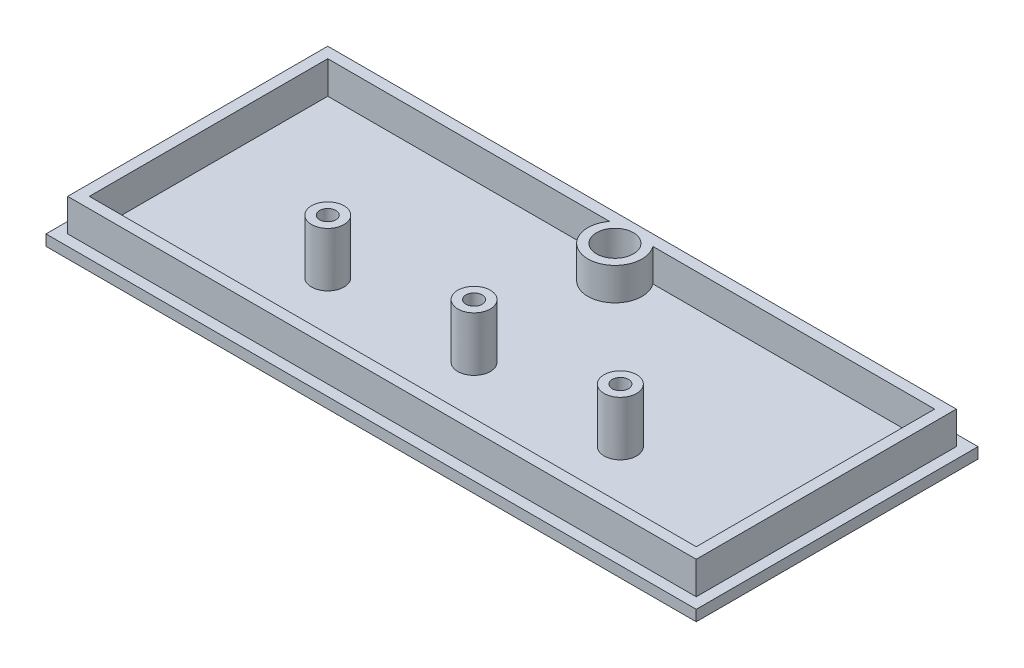
from build123d import *

# Parameters (mm, degrees)
SKETCH1_W                                       = 60
SKETCH1_H                                       = 26
BOSS_EXTRUDE1_DEPTH                             = 1
SKETCH2_W                                       = 58
SKETCH2_H                                       = 24
SKETCH2_W_2                                     = 56
SKETCH2_H_2                                     = 22
BOSS_EXTRUDE2_DEPTH                             = 3
SKETCH3_R                                       = 1.5
SKETCH3_R_2                                     = 0.75
BOSS_EXTRUDE3_DEPTH                             = 5
SKETCH6_R                                       = 2.5
BOSS_EXTRUDE4_DEPTH                             = 3
CSK_FOR_M3_FLAT_HEAD_MACHINE_SCREW1_D           = 3.4
CSK_FOR_M3_FLAT_HEAD_MACHINE_SCREW1_CSINK_D     = 6.3
CSK_FOR_M3_FLAT_HEAD_MACHINE_SCREW1_CSINK_ANGLE = 90


with BuildPart() as part:
    # Sketch1 → Boss-Extrude1 (new body)
    with BuildSketch(Plane(origin=(0, 0, 0), x_dir=(1, 0, 0), z_dir=(0, 1, 0))):
        with Locations((30, 13)):
            Rectangle(SKETCH1_W, SKETCH1_H)
    extrude(amount=BOSS_EXTRUDE1_DEPTH)

    # Sketch2 → Boss-Extrude2 (add)
    with BuildSketch(Plane(origin=(0, 1, 0), x_dir=(1, 0, 0), z_dir=(0, 1, 0))):
        with Locations((30, 13)):
            Rectangle(SKETCH2_W, SKETCH2_H)
        with Locations((30, 13)):
            Rectangle(SKETCH2_W_2, SKETCH2_H_2, mode=Mode.SUBTRACT)
    extrude(amount=BOSS_EXTRUDE2_DEPTH)

    # Sketch3 → Boss-Extrude3 (add)
    # profile 1 of 3: a face of its own
    with BuildSketch(Plane(origin=(0, 1, 0), x_dir=(1, 0, 0), z_dir=(0, 1, 0))):
        with Locations((16.5, 9.5)):
            Circle(SKETCH3_R)
        with Locations((16.5, 9.5)):
            Circle(SKETCH3_R_2, mode=Mode.SUBTRACT)
    # profile 2 of 3: a face of its own
    with BuildSketch(Plane(origin=(0, 1, 0), x_dir=(1, 0, 0), z_dir=(0, 1, 0))):
        with Locations((30, 9.5)):
            Circle(SKETCH3_R)
        with Locations((30, 9.5)):
            Circle(SKETCH3_R_2, mode=Mode.SUBTRACT)
    # profile 3 of 3: a face of its own
    with BuildSketch(Plane(origin=(0, 1, 0), x_dir=(1, 0, 0), z_dir=(0, 1, 0))):
        with Locations((43.5, 9.5)):
            Circle(SKETCH3_R)
        with Locations((43.5, 9.5)):
            Circle(SKETCH3_R_2, mode=Mode.SUBTRACT)
    extrude(amount=BOSS_EXTRUDE3_DEPTH)

    # Sketch6 → Boss-Extrude4 (add)
    with BuildSketch(Plane(origin=(0, 1, 0), x_dir=(1, 0, 0), z_dir=(0, 1, 0))):
        with Locations((30, 22.5)):
            Circle(SKETCH6_R)
    extrude(amount=BOSS_EXTRUDE4_DEPTH)

    # CSK for M3 Flat Head Machine Screw1 (through all)
    with Locations(Plane(origin=(0, 0, 0), x_dir=(-1, 0, 0), z_dir=(0, -1, 0))):
        with Locations((-30, 22.5)):
            CounterSinkHole(CSK_FOR_M3_FLAT_HEAD_MACHINE_SCREW1_D / 2, CSK_FOR_M3_FLAT_HEAD_MACHINE_SCREW1_CSINK_D / 2, counter_sink_angle=CSK_FOR_M3_FLAT_HEAD_MACHINE_SCREW1_CSINK_ANGLE)


solid = part.part
